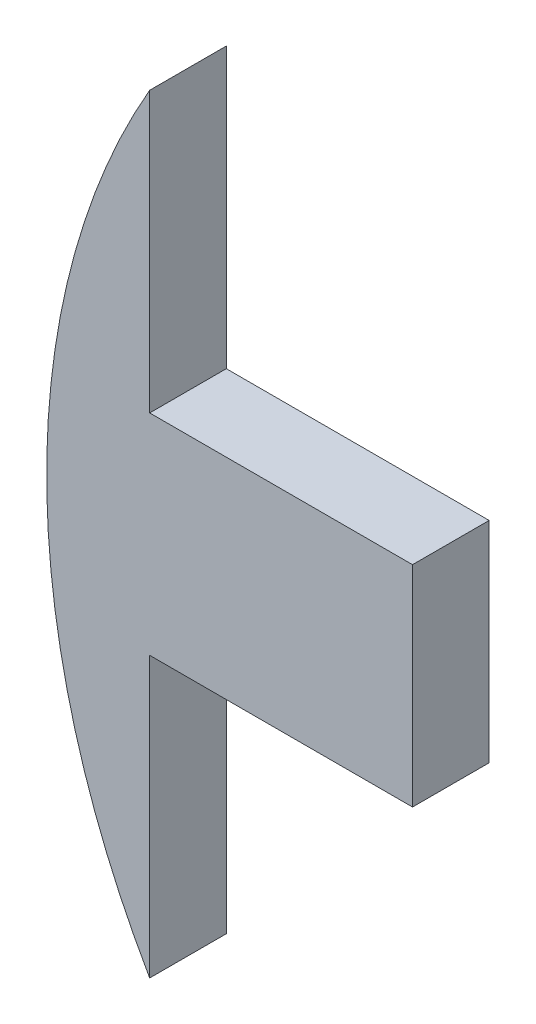
from build123d import *

# Parameters (mm, degrees)
BOSS_EXTRUDE2_DEPTH = 3.03


with BuildPart() as part:
    # Sketch4 → Boss-Extrude2 (new body)
    with BuildSketch(Plane.XY):
        with BuildLine():
            ThreePointArc((-10.547054114, 19.169106214), (-14.619881839, 3.969106214), (-10.547054114, -11.230893786))
            Line((-10.547054114, -11.230893786), (-10.547054114, -0.180893786))
            Line((-10.547054114, -0.180893786), (-0.154749269, -0.180893786))
            Line((-0.154749269, -0.180893786), (-0.154749269, 8.119106214))
            Line((-0.154749269, 8.119106214), (-10.547054114, 8.119106214))
            Line((-10.547054114, 8.119106214), (-10.547054114, 19.169106214))
        make_face()
    extrude(amount=BOSS_EXTRUDE2_DEPTH)


solid = part.part
